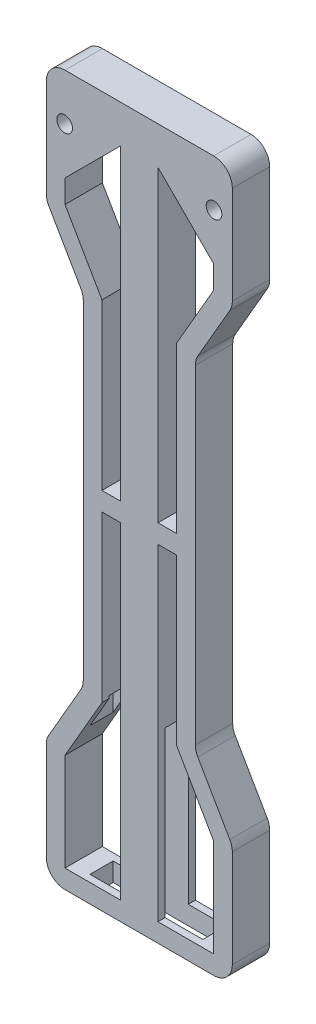
from build123d import *

# Parameters (mm, degrees)
SKETCH_1_W          = 49.8
SKETCH_1_H          = 190
EXTRUDE_1_DEPTH     = 5
CUT_EXTRUDE_1_DEPTH = 99.71681721
FILLET_1_R          = 5
CUT_EXTRUDE_2_DEPTH = 99.71681721
CHAMFER_2_SIZE      = 20
CUT_EXTRUDE_6_REACH = 100.717
SKETCH_7_R          = 2.1
SKETCH_3_W          = 30.2
SKETCH_3_H          = 6.2
CUT_EXTRUDE_7_DEPTH = 49
CHAMFER_3_SIZE      = 5
SKETCH_9_R          = 3.7
CUT_EXTRUDE_8_DEPTH = 5


with BuildPart() as part:
    # 草图1 → 凸台-拉伸1 (new, symmetric)
    with BuildSketch(Plane.XY):
        Rectangle(SKETCH_1_W, SKETCH_1_H)
    extrude(amount=EXTRUDE_1_DEPTH, both=True)

    # 草图4 → 切除-拉伸1 (cut, through all)
    with BuildSketch(Plane(origin=(0, 0, -5), x_dir=(-1, 0, 0), z_dir=(0, 0, -1))):
        Polygon((-24.9, 62.5), (-15, 45.352697005), (-15, -45.352697005), (-24.9, -62.5), align=None)
        Polygon((24.9, -62.5), (24.9, 62.5), (15, 45.352697005), (15, -45.352697005), align=None)
    extrude(amount=-CUT_EXTRUDE_1_DEPTH, mode=Mode.SUBTRACT)

    # 圆角1
    fillet_1_edges = [part.edges().sort_by_distance(p)[0] for p in [
        (24.9, -62.5, 0),
        (24.9, 62.5, 0),
        (15, 45.352697005, 0),
        (15, -45.352697005, 0),
        (-24.9, -62.5, 0),
        (-15, -45.352697005, 0),
        (-15, 45.352697005, 0),
        (-24.9, 62.5, 0),
        (24.9, -95, 0),
        (-24.9, -95, 0),
        (-24.9, 95, 0),
        (24.9, 95, 0),
    ]]
    fillet(fillet_1_edges, radius=FILLET_1_R)

    # 草图5 → 切除-拉伸2 (cut, through all)
    with BuildSketch(Plane(origin=(0, 0, -5), x_dir=(-1, 0, 0), z_dir=(0, 0, -1))):
        Polygon((-19.9, 90), (-19.9, 63.839745962), (-10, 46.692442967), (-10, 2.5), (-5, 2.5), (-5, 90), align=None)
        Polygon((5, 90), (19.9, 90), (19.9, 63.839745962), (10, 46.692442967), (10, 2.5), (5, 2.5), align=None)
        Polygon((19.9, -90), (19.9, -63.839745962), (10, -46.692442967), (10, -2.5), (5, -2.5), (5, -90), align=None)
        Polygon((-5, -90), (-19.9, -90), (-19.9, -63.839745962), (-10, -46.692442967), (-10, -2.5), (-5, -2.5), align=None)
    extrude(amount=-CUT_EXTRUDE_2_DEPTH, mode=Mode.SUBTRACT)

    # 倒角2
    # the kernel refuses this chamfer: 20 mm, written as the material it adds along each edge
    with BuildSketch(Plane(origin=(-19.9, 90, -5), x_dir=(-0.027495876610586147, -0.9996219169112968, 0), z_dir=(0, 0, 1))) as chamfer_2_piece_1:
        Polygon((CHAMFER_2_SIZE * 0.999621916911, CHAMFER_2_SIZE * 0.0274958766106), (-CHAMFER_2_SIZE * 0.0274958766106, CHAMFER_2_SIZE * 0.999621916911), (0, 0), align=None)
    extrude(amount=10)
    with BuildSketch(Plane(origin=(19.9, 90, -5), x_dir=(0.027495876610586147, -0.9996219169112968, 0), z_dir=(0, 0, 1))) as chamfer_2_piece_2:
        Polygon((CHAMFER_2_SIZE * 0.999621916911, -CHAMFER_2_SIZE * 0.0274958766106), (-CHAMFER_2_SIZE * 0.0274958766106, -CHAMFER_2_SIZE * 0.999621916911), (0, 0), align=None)
    extrude(amount=10)

    # 草图7 → 切除-拉伸6 (cut, up to next)
    with BuildSketch(Plane(origin=(0, 0, -5), x_dir=(-1, 0, 0), z_dir=(0, 0, -1)), mode=Mode.PRIVATE) as cut_extrude_6_sk1:
        with Locations((-20, 82.5)):
            Circle(SKETCH_7_R)
    cut_extrude_6_tool1 = extrude(cut_extrude_6_sk1.sketch, amount=-CUT_EXTRUDE_6_REACH, mode=Mode.PRIVATE) & part.part
    # 草图7 → 切除-拉伸6 (cut, up to next)
    with BuildSketch(Plane(origin=(0, 0, -5), x_dir=(-1, 0, 0), z_dir=(0, 0, -1)), mode=Mode.PRIVATE) as cut_extrude_6_sk2:
        with Locations(Location((20, 82.5, 0), (0, 0, 180))):
            Circle(SKETCH_7_R)
    cut_extrude_6_tool2 = extrude(cut_extrude_6_sk2.sketch, amount=-CUT_EXTRUDE_6_REACH, mode=Mode.PRIVATE) & part.part
    add(cut_extrude_6_tool1.solids().sort_by_distance((20, 82.5, -5))[0], mode=Mode.SUBTRACT)
    add(cut_extrude_6_tool2.solids().sort_by_distance((-20, 82.5, -5))[0], mode=Mode.SUBTRACT)

    # 草图3 → 切除-拉伸7 (cut)
    with BuildSketch(Plane.XZ.offset(95)):
        Rectangle(SKETCH_3_W, SKETCH_3_H)
    extrude(amount=-CUT_EXTRUDE_7_DEPTH, mode=Mode.SUBTRACT)

    # 倒角3
    chamfer_3_edges = [part.edges().sort_by_distance(p)[0] for p in [
        (-15.1, -46, 0),
        (15.1, -46, 0),
    ]]
    chamfer(chamfer_3_edges, length=CHAMFER_3_SIZE)

    # 草图9 → 切除-拉伸8 (cut)
    with BuildSketch(Plane(origin=(0, 0, -5), x_dir=(-1, 0, 0), z_dir=(0, 0, -1))):
        with Locations((-20, 82.5)):
            Circle(SKETCH_9_R)
        with Locations((20, 82.5)):
            Circle(SKETCH_9_R)
    extrude(amount=-CUT_EXTRUDE_8_DEPTH, mode=Mode.SUBTRACT)


solid = part.part
